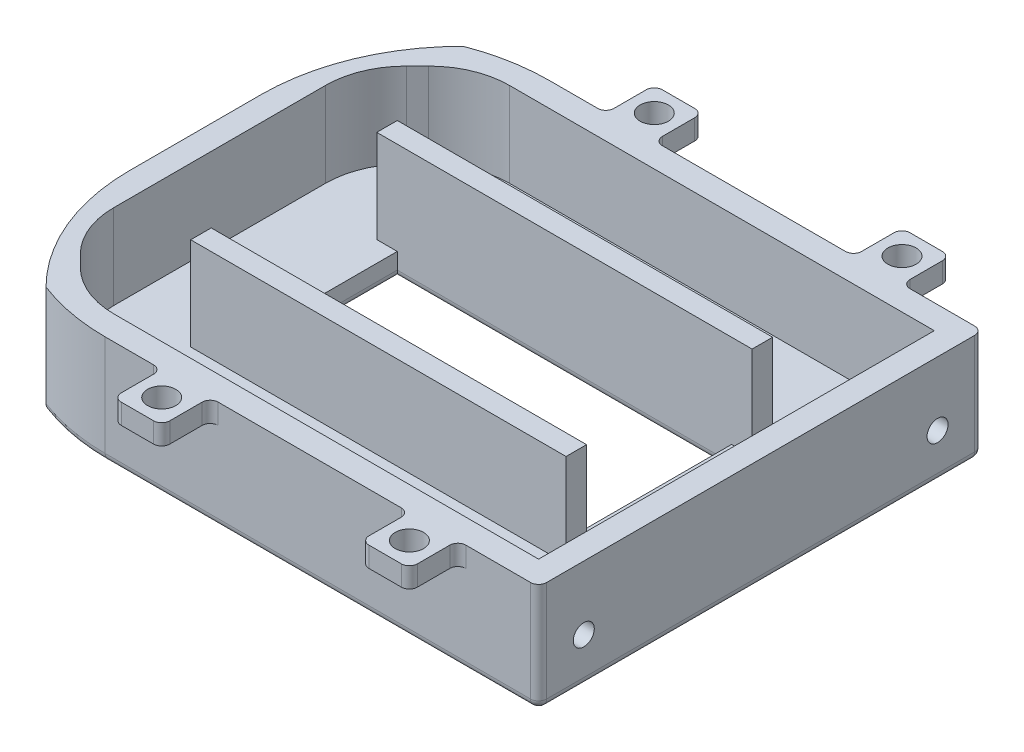
from build123d import *

# Parameters (mm, degrees)
BOSS_EXTRUDE1_DEPTH          = 30
SHELL2_T                     = 3
CUT_EXTRUDE2_REACH           = 183.177
BOSS_EXTRUDE5_DEPTH          = 25.5
SKETCH17_W                   = 8
SKETCH17_H                   = 25.58
BOSS_EXTRUDE6_DEPTH          = 5
CUT_EXTRUDE3_REACH           = 182.934
SKETCH18_R                   = 1.75
SKETCH20_W                   = 197.48203017
SKETCH20_H                   = 83.172325934
CUT_EXTRUDE4_DEPTH           = 16.5
CUT_EXTRUDE5_REACH           = 180.984
OUTLINE_OF_MOTOR_PRESS_FIT_W = 41.4
OUTLINE_OF_MOTOR_PRESS_FIT_H = 20.5
SKETCH24_W                   = 46.48
SKETCH24_H                   = 2.54
BOSS_EXTRUDE7_DEPTH          = 1
CUT_EXTRUDE6_DEPTH           = 180.263074837
CUT_EXTRUDE6_DEPTH_BACK      = 180.263074837
SKETCH26_W                   = 55
SKETCH26_H                   = 13.5
BOSS_EXTRUDE8_DEPTH          = 3
FILLET1_R                    = 25
FILLET2_R                    = 25
SKETCH28_W                   = 6
SKETCH28_H                   = 6
SKETCH28_R                   = 1.75
BOSS_EXTRUDE9_DEPTH          = 2.5
FILLET3_R                    = 1
FILLET4_R                    = 10
CUT_EXTRUDE7_REACH           = 95.975
SKETCH30_R                   = 1.3


with BuildPart() as part:
    # Sketch1 → Boss-Extrude1 (new body)
    with BuildSketch(Plane(origin=(0, 0, 0), x_dir=(1, 0, 0), z_dir=(0, 1, 0))):
        Polygon((0, 46), (9, 55), (161, 55), (170, 46), (170, 9), (161, 0), (9, 0), (0, 9), align=None)
    extrude(amount=BOSS_EXTRUDE1_DEPTH)

    # Shell2 (no face opened: a closed hollow body)
    add(offset(amount=-SHELL2_T, mode=Mode.PRIVATE), mode=Mode.SUBTRACT)

    # Sketch2 → Cut-Extrude2 (cut, up to next)
    with BuildSketch(Plane(origin=(0, 30, 0), x_dir=(1, 0, 0), z_dir=(0, 1, 0)), mode=Mode.PRIVATE) as cut_extrude2_sk1:
        Polygon((3, 44.757359313), (3, 10.242640687), (10.242640687, 3), (159.757359313, 3), (167, 10.242640687), (167, 44.757359313), (159.757359313, 52), (10.242640687, 52), align=None)
    cut_extrude2_tool1 = extrude(cut_extrude2_sk1.sketch, amount=-CUT_EXTRUDE2_REACH, mode=Mode.PRIVATE) & part.part
    add(cut_extrude2_tool1.solids().sort_by_distance((85, 30, -27.5))[0], mode=Mode.SUBTRACT)

    # Sketch16 → Boss-Extrude5 (add)
    with BuildSketch(Plane(origin=(0, 3, 0), x_dir=(1, 0, 0), z_dir=(0, 1, 0))):
        Polygon((52.69, 40.29), (18.21, 40.29), (12.21, 40.29), (12.21, 37.75), (14.75, 37.75), (18.21, 37.75), (52.69, 37.75), (56.15, 37.75), (58.69, 37.75), (58.69, 40.29), align=None)
        Polygon((18.21, 17.25), (52.69, 17.25), (56.15, 17.25), (58.69, 17.25), (58.69, 14.71), (52.69, 14.71), (18.21, 14.71), (12.21, 14.71), (12.21, 17.25), (14.75, 17.25), align=None)
    extrude(amount=BOSS_EXTRUDE5_DEPTH)

    # Sketch17 → Boss-Extrude6 (add)
    with BuildSketch(Plane(origin=(0, 28.5, 0), x_dir=(1, 0, 0), z_dir=(0, 1, 0))):
        with Locations((60.192970397, 27.5)):
            Rectangle(SKETCH17_W, SKETCH17_H)
        with Locations((10.75, 27.5)):
            Rectangle(SKETCH17_W, SKETCH17_H)
    extrude(amount=-BOSS_EXTRUDE6_DEPTH)

    # Sketch18 → Cut-Extrude3 (cut, up to next)
    with BuildSketch(Plane(origin=(0, 28.5, 0), x_dir=(1, 0, 0), z_dir=(0, 1, 0)), mode=Mode.PRIVATE) as cut_extrude3_sk1:
        with Locations(Location((59.75, 32.5, 0), (0, 0, 270))):
            Circle(SKETCH18_R)
    cut_extrude3_tool1 = extrude(cut_extrude3_sk1.sketch, amount=-CUT_EXTRUDE3_REACH, mode=Mode.PRIVATE) & part.part
    # Sketch18 → Cut-Extrude3 (cut, up to next)
    with BuildSketch(Plane(origin=(0, 28.5, 0), x_dir=(1, 0, 0), z_dir=(0, 1, 0)), mode=Mode.PRIVATE) as cut_extrude3_sk2:
        with Locations(Location((59.75, 22.5, 0), (0, 0, 270))):
            Circle(SKETCH18_R)
    cut_extrude3_tool2 = extrude(cut_extrude3_sk2.sketch, amount=-CUT_EXTRUDE3_REACH, mode=Mode.PRIVATE) & part.part
    # Sketch18 → Cut-Extrude3 (cut, up to next)
    with BuildSketch(Plane(origin=(0, 28.5, 0), x_dir=(1, 0, 0), z_dir=(0, 1, 0)), mode=Mode.PRIVATE) as cut_extrude3_sk3:
        with Locations(Location((11.15, 22.5, 0), (0, 0, 270))):
            Circle(SKETCH18_R)
    cut_extrude3_tool3 = extrude(cut_extrude3_sk3.sketch, amount=-CUT_EXTRUDE3_REACH, mode=Mode.PRIVATE) & part.part
    # Sketch18 → Cut-Extrude3 (cut, up to next)
    with BuildSketch(Plane(origin=(0, 28.5, 0), x_dir=(1, 0, 0), z_dir=(0, 1, 0)), mode=Mode.PRIVATE) as cut_extrude3_sk4:
        with Locations(Location((11.15, 32.5, 0), (0, 0, 270))):
            Circle(SKETCH18_R)
    cut_extrude3_tool4 = extrude(cut_extrude3_sk4.sketch, amount=-CUT_EXTRUDE3_REACH, mode=Mode.PRIVATE) & part.part
    add(cut_extrude3_tool1.solids().sort_by_distance((59.75, 28.5, -32.5))[0], mode=Mode.SUBTRACT)
    add(cut_extrude3_tool2.solids().sort_by_distance((59.75, 28.5, -22.5))[0], mode=Mode.SUBTRACT)
    add(cut_extrude3_tool3.solids().sort_by_distance((11.15, 28.5, -22.5))[0], mode=Mode.SUBTRACT)
    add(cut_extrude3_tool4.solids().sort_by_distance((11.15, 28.5, -32.5))[0], mode=Mode.SUBTRACT)

    # Sketch20 → Cut-Extrude4 (cut)
    with BuildSketch(Plane(origin=(0, 30, 0), x_dir=(1, 0, 0), z_dir=(0, 1, 0))):
        with Locations((90.328880179, 24.260876754)):
            Rectangle(SKETCH20_W, SKETCH20_H)
    extrude(amount=-CUT_EXTRUDE4_DEPTH, mode=Mode.SUBTRACT)

    # Outline of motor press fit → Cut-Extrude5 (cut, up to next)
    with BuildSketch(Plane(origin=(0, 3, 0), x_dir=(1, 0, 0), z_dir=(0, 1, 0)), mode=Mode.PRIVATE) as cut_extrude5_sk1:
        with Locations((35.45, 27.5)):
            Rectangle(OUTLINE_OF_MOTOR_PRESS_FIT_W, OUTLINE_OF_MOTOR_PRESS_FIT_H)
    cut_extrude5_tool1 = extrude(cut_extrude5_sk1.sketch, amount=-CUT_EXTRUDE5_REACH, mode=Mode.PRIVATE) & part.part
    add(cut_extrude5_tool1.solids().sort_by_distance((35.45, 3, -27.5))[0], mode=Mode.SUBTRACT)

    # Sketch24 → Boss-Extrude7 (add)
    with BuildSketch(Plane(origin=(0, 13.5, 0), x_dir=(1, 0, 0), z_dir=(0, 1, 0))):
        with Locations((35.45, 39.02)):
            Rectangle(SKETCH24_W, SKETCH24_H)
        with Locations((35.45, 15.98)):
            Rectangle(SKETCH24_W, SKETCH24_H)
    extrude(amount=BOSS_EXTRUDE7_DEPTH)

    # Sketch25 → Cut-Extrude6 (cut, two sides: drawn at the far end of the back side and taken through both)
    with BuildSketch(Plane.XZ.offset(-CUT_EXTRUDE6_DEPTH_BACK)):
        Polygon((70, 13.461759558), (70, -84.299003111), (188.235365379, -84.299003111), (188.235365379, 23.0423143), (70, 19.718448369), align=None)
    extrude(amount=CUT_EXTRUDE6_DEPTH + CUT_EXTRUDE6_DEPTH_BACK, mode=Mode.SUBTRACT)

    # Sketch26 → Boss-Extrude8 (add)
    with BuildSketch(Plane(origin=(70, 0, 0), x_dir=(0, 0, -1), z_dir=(1, 0, 0))):
        with Locations((27.5, 6.75)):
            Rectangle(SKETCH26_W, SKETCH26_H)
    extrude(amount=-BOSS_EXTRUDE8_DEPTH)

    # Fillet1
    fillet1_edges = [part.edges().sort_by_distance(p)[0] for p in [
        (0, 6.75, -46),
        (0, 6.75, -9),
    ]]
    fillet(fillet1_edges, radius=FILLET1_R)

    # Fillet2
    # the kernel refuses this fillet: 25 mm, written as the material it takes off along each edge
    with BuildSketch(Plane(origin=(9, -18.315393785, 0), x_dir=(-0.7071067811865396, 0, -0.7071067811865553), z_dir=(0, 1, 0))) as fillet2_piece_1:
        with BuildLine():
            CenterArc((12.497293871, -22.858045188), FILLET2_R, 113.890402407, 21.109597593)
            Line((-5.180375658, -5.180375658), (-5.533929049, -4.826822268))
            Line((-5.533929049, -4.826822268), (-0.353553391, 0.353553391))
            Line((-0.353553391, 0.353553391), (0, 0.5))
            ThreePointArc((0, 0.5), (1.186291501, 0.5), (2.170088785, 0.457160904))
            Line((2.170088785, 0.457160904), (2.372583002, 0))
        make_face()
    extrude(amount=50.13078757, mode=Mode.SUBTRACT)
    with BuildSketch(Plane(origin=(9, -18.315393785, -55), x_dir=(-0.7071067811865434, 0, 0.7071067811865516), z_dir=(0, 1, 0))) as fillet2_piece_2:
        with BuildLine():
            CenterArc((12.497293871, 22.858045188), FILLET2_R, 225, 21.109597593)
            Line((-5.180375658, 5.180375658), (-5.533929049, 4.826822268))
            Line((-5.533929049, 4.826822268), (-0.353553391, -0.353553391))
            Line((-0.353553391, -0.353553391), (0, -0.5))
            ThreePointArc((0, -0.5), (1.186291501, -0.5), (2.170088785, -0.457160904))
            Line((2.170088785, -0.457160904), (2.372583002, 0))
        make_face()
    extrude(amount=50.13078757, mode=Mode.SUBTRACT)

    # Sketch28 → Boss-Extrude9 (add)
    # profile 1 of 4: a face of its own
    with BuildSketch(Plane(origin=(0, 13.5, 0), x_dir=(1, 0, 0), z_dir=(0, 1, 0))):
        with Locations((26.326157514, 58)):
            Rectangle(SKETCH28_W, SKETCH28_H)
        with Locations(Location((26.326157514, 58, 0), (0, 0, 270))):
            Circle(SKETCH28_R, mode=Mode.SUBTRACT)
    # profile 2 of 4: a face of its own
    with BuildSketch(Plane(origin=(0, 13.5, 0), x_dir=(1, 0, 0), z_dir=(0, 1, 0))):
        with Locations((57, 58)):
            Rectangle(SKETCH28_W, SKETCH28_H)
        with Locations(Location((57, 58, 0), (0, 0, 270))):
            Circle(SKETCH28_R, mode=Mode.SUBTRACT)
    # profile 3 of 4: a face of its own
    with BuildSketch(Plane(origin=(0, 13.5, 0), x_dir=(1, 0, 0), z_dir=(0, 1, 0))):
        with Locations((57, -3)):
            Rectangle(SKETCH28_W, SKETCH28_H)
        with Locations(Location((57, -3, 0), (0, 0, 270))):
            Circle(SKETCH28_R, mode=Mode.SUBTRACT)
    # profile 4 of 4: a face of its own
    with BuildSketch(Plane(origin=(0, 13.5, 0), x_dir=(1, 0, 0), z_dir=(0, 1, 0))):
        with Locations((26.326157514, -3)):
            Rectangle(SKETCH28_W, SKETCH28_H)
        with Locations(Location((26.326157514, -3, 0), (0, 0, 270))):
            Circle(SKETCH28_R, mode=Mode.SUBTRACT)
    extrude(amount=-BOSS_EXTRUDE9_DEPTH)

    # Fillet3
    fillet3_edges = [part.edges().sort_by_distance(p)[0] for p in [
        (14.75, 0, -27.5),
        (35.45, 0, -37.75),
        (56.15, 0, -27.5),
        (35.45, 0, -17.25),
        (43.163078757, 0, -55),
        (70, 0, -27.5),
        (70, 6.75, -55),
        (70, 6.75, 0),
        (0, 0, -27.5),
        (1.903011687, 0, -45.21174675),
        (1.903011687, 0, -9.78825325),
        (43.163078757, 0, 0),
        (11.746761362, 0, -54.577004107),
        (11.746761362, 0, -0.422995893),
        (23.326157514, 12.25, 0),
        (29.326157514, 12.25, 0),
        (29.326157514, 12.25, 6),
        (23.326157514, 12.25, 6),
        (60, 12.25, 0),
        (60, 12.25, 6),
        (54, 12.25, 6),
        (54, 12.25, 0),
        (54, 12.25, -55),
        (54, 12.25, -61),
        (60, 12.25, -61),
        (60, 12.25, -55),
        (29.326157514, 12.25, -55),
        (23.326157514, 12.25, -55),
        (23.326157514, 12.25, -61),
        (29.326157514, 12.25, -61),
    ]]
    fillet(fillet3_edges, radius=FILLET3_R)

    # Fillet4
    fillet4_edges = [part.edges().sort_by_distance(p)[0] for p in [
        (10.242640687, 8.25, -52),
        (3, 8.25, -44.757359313),
        (10.242640687, 8.25, -3),
        (3, 8.25, -10.242640687),
    ]]
    fillet(fillet4_edges, radius=FILLET4_R)

    # Sketch30 → Cut-Extrude7 (cut, up to next)
    with BuildSketch(Plane(origin=(70, 0, 0), x_dir=(0, 0, -1), z_dir=(1, 0, 0)), mode=Mode.PRIVATE) as cut_extrude7_sk1:
        with Locations((5.596194078, 5.596194078)):
            Circle(SKETCH30_R)
    cut_extrude7_tool1 = extrude(cut_extrude7_sk1.sketch, amount=-CUT_EXTRUDE7_REACH, mode=Mode.PRIVATE) & part.part
    # Sketch30 → Cut-Extrude7 (cut, up to next)
    with BuildSketch(Plane(origin=(70, 0, 0), x_dir=(0, 0, -1), z_dir=(1, 0, 0)), mode=Mode.PRIVATE) as cut_extrude7_sk2:
        with Locations((49.403805922, 5.596194078)):
            Circle(SKETCH30_R)
    cut_extrude7_tool2 = extrude(cut_extrude7_sk2.sketch, amount=-CUT_EXTRUDE7_REACH, mode=Mode.PRIVATE) & part.part
    add(cut_extrude7_tool1.solids().sort_by_distance((70, 5.596194, -5.596194))[0], mode=Mode.SUBTRACT)
    add(cut_extrude7_tool2.solids().sort_by_distance((70, 5.596194, -49.403806))[0], mode=Mode.SUBTRACT)


solid = part.part
